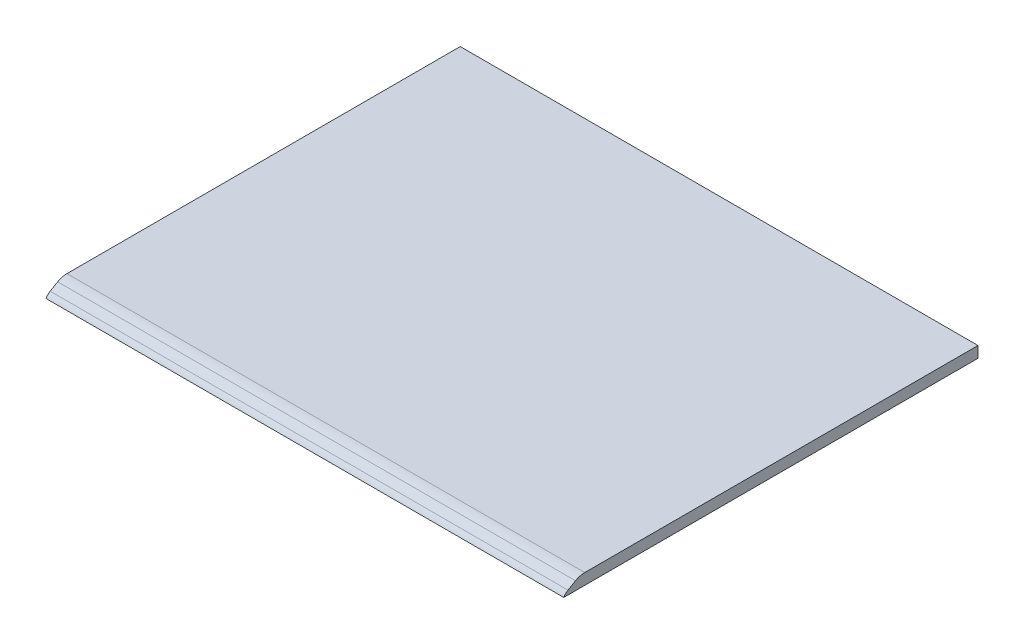
from build123d import *

# Parameters (mm, degrees)
SKETCH_1_W      = 140
SKETCH_1_H      = 112
EXTRUDE_1_DEPTH = 3
CHAMFER_1_SIZE  = 2.5
CHAMFER_1_SIZE2 = 4.330127019
FILLET_1_R      = 5
FILLET_2_R      = 3


with BuildPart() as part:
    # Эскиз1 → Бобышка-Вытянуть1 (new body)
    with BuildSketch(Plane(origin=(0, 0, 0), x_dir=(1, 0, 0), z_dir=(0, 1, 0))):
        Rectangle(SKETCH_1_W, SKETCH_1_H)
    extrude(amount=EXTRUDE_1_DEPTH)

    # Фаска1
    chamfer_1_edges = [part.edges().sort_by_distance(p)[0] for p in [
        (0, 3, 56),
    ]]
    chamfer_1_side = [part.faces().sort_by_distance(p)[0] for p in [
        (0, 1.5, 56),
    ]]
    chamfer(chamfer_1_edges, length=CHAMFER_1_SIZE, length2=CHAMFER_1_SIZE2, reference=chamfer_1_side[0])

    # Скругление1
    fillet_1_edges = [part.edges().sort_by_distance(p)[0] for p in [
        (0, 3, 51.669872981),
    ]]
    fillet(fillet_1_edges, radius=FILLET_1_R)

    # Скругление2
    # the kernel refuses this fillet: 3 mm, written as the material it takes off along each edge
    with BuildSketch(Plane(origin=(73.256507609, 0.5, 56), x_dir=(0, 0.49999999999999795, -0.8660254037844398), z_dir=(-1, 0, 0))) as fillet_2_piece_1:
        with BuildLine():
            CenterArc((1.302603044, 3), FILLET_2_R, 238.832994719, 31.167005281)
            Line((-0.25, 0.433012702), (-0.281052061, 0.381672956))
            ThreePointArc((-0.281052061, 0.381672956), (-0.176961524, 0.186506351), (-0.051961524, -0.03))
            Line((-0.051961524, -0.03), (0, -0.06))
            Line((0, -0.06), (1.302603044, -0.06))
            Line((1.302603044, -0.06), (1.302603044, 0))
        make_face()
    extrude(amount=146.513015219, mode=Mode.SUBTRACT)


solid = part.part
